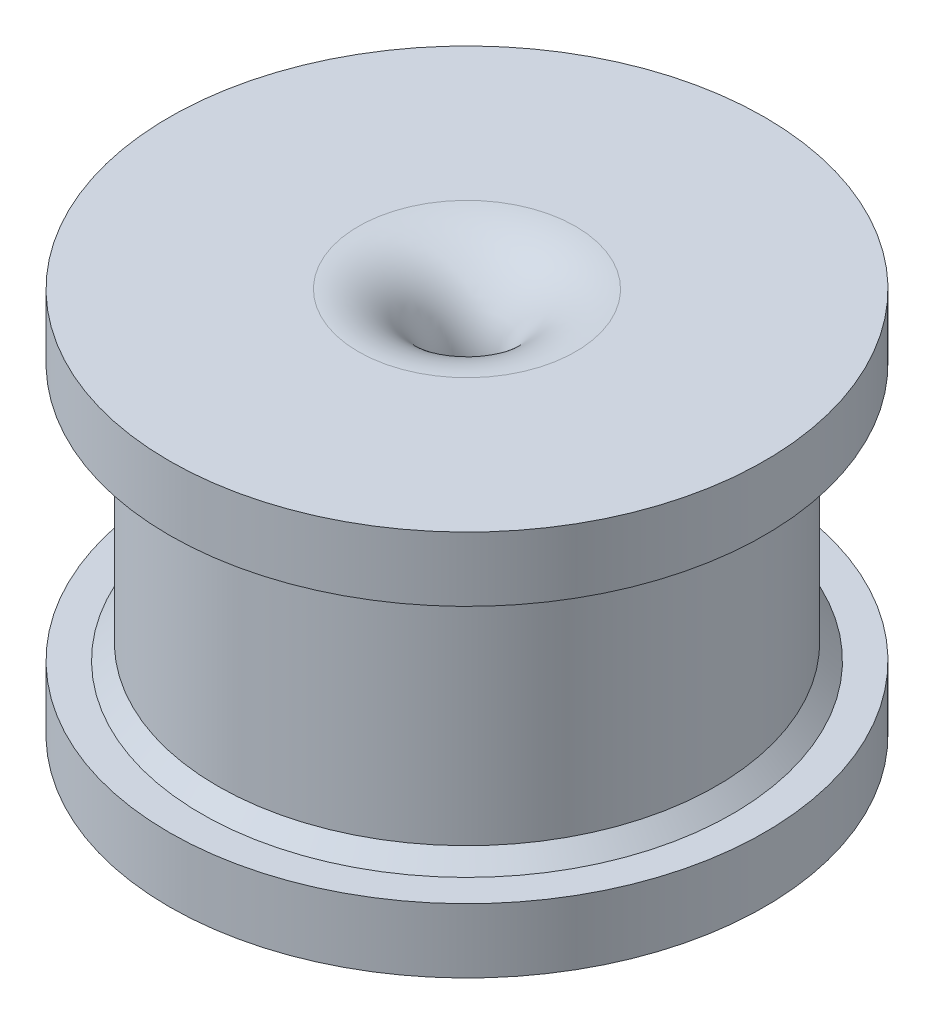
from build123d import *

# Parameters (mm, degrees)
SKETCH1_R           = 15.5
SKETCH1_R_2         = 1.75
BOSS_EXTRUDE1_DEPTH = 16
SKETCH2_R           = 18.5
SKETCH2_R_2         = 1.75
BOSS_EXTRUDE2_DEPTH = 4
BOSS_EXTRUDE3_START = 4
SKETCH3_R           = 18.5
SKETCH3_R_2         = 1.75
BOSS_EXTRUDE3_DEPTH = 4
FILLET1_R           = 5
CHAMFER1_SIZE       = 1


with BuildPart() as part:
    # Sketch1 → Boss-Extrude1 (new body)
    with BuildSketch(Plane(origin=(0, 0, 0), x_dir=(1, 0, 0), z_dir=(0, 1, 0))):
        with Locations(Location((0, 0, 0), (0, 0, 270))):
            Circle(SKETCH1_R)
        with Locations(Location((0, 0, 0), (0, 0, 270))):
            Circle(SKETCH1_R_2, mode=Mode.SUBTRACT)
    extrude(amount=BOSS_EXTRUDE1_DEPTH)

    # Sketch2 → Boss-Extrude2 (add)
    with BuildSketch(Plane(origin=(0, 16, 0), x_dir=(1, 0, 0), z_dir=(0, 1, 0))):
        with Locations(Location((0, 0, 0), (0, 0, 270))):
            Circle(SKETCH2_R)
        with Locations(Location((0, 0, 0), (0, 0, 270))):
            Circle(SKETCH2_R_2, mode=Mode.SUBTRACT)
    extrude(amount=BOSS_EXTRUDE2_DEPTH)

    # Sketch3 → Boss-Extrude3 (add)
    with BuildSketch(Plane.XZ.offset(BOSS_EXTRUDE3_START)):
        with Locations(Location((0, 0, 0), (0, 0, 90))):
            Circle(SKETCH3_R)
        with Locations(Location((0, 0, 0), (0, 0, 270))):
            Circle(SKETCH3_R_2, mode=Mode.SUBTRACT)
    extrude(amount=-BOSS_EXTRUDE3_DEPTH)

    # Fillet1
    # the kernel refuses this fillet: 5 mm, written as the material it takes off along each edge
    with BuildSketch(Plane(origin=(0, 20, 0), x_dir=(0, 0, 1), z_dir=(-1, 0, 0))) as fillet1_piece_1:
        with BuildLine():
            CenterArc((1.75 + FILLET1_R, -FILLET1_R), FILLET1_R, 90, 90)
            Line((1.75, -FILLET1_R), (1.75, 0))
            Line((1.75, 0), (1.75 + FILLET1_R, 0))
        make_face()
    revolve(axis=Axis((0, 20, 0), (0, 1, 0)), mode=Mode.SUBTRACT)
    with BuildSketch(Plane(origin=(0, -4, 0), x_dir=(0, 0, -1), z_dir=(-1, 0, 0))) as fillet1_piece_2:
        with BuildLine():
            CenterArc((1.75 + FILLET1_R, -FILLET1_R), FILLET1_R, 90, 90)
            Line((1.75, -FILLET1_R), (1.75, 0))
            Line((1.75, 0), (1.75 + FILLET1_R, 0))
        make_face()
    revolve(axis=Axis((0, -4, 0), (0, -1, 0)), mode=Mode.SUBTRACT)

    # Chamfer1
    chamfer1_edges = [part.edges().sort_by_distance(p)[0] for p in [
        (0, 0, -15.5),
        (0, 16, -15.5),
    ]]
    chamfer(chamfer1_edges, length=CHAMFER1_SIZE)


solid = part.part
